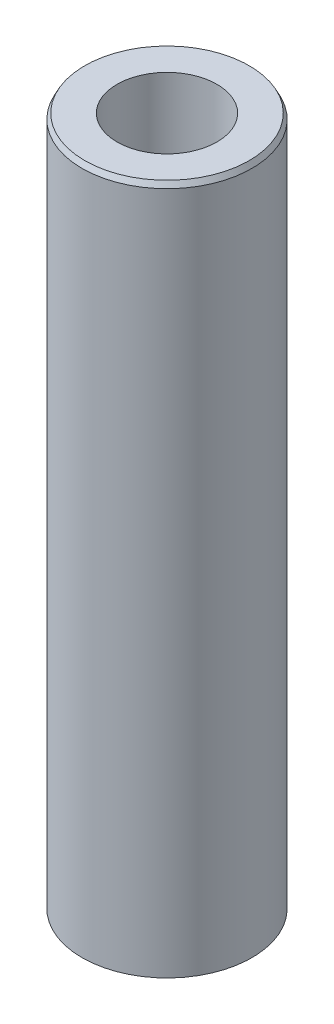
from build123d import *
from OCP.BRepFilletAPI import BRepFilletAPI_MakeChamfer

# Parameters (mm, degrees)
SKETCH1_R           = 47.5
BOSS_EXTRUDE1_DEPTH = 386.580082603
SKETCH2_R           = 27.935158564
CUT_EXTRUDE1_DEPTH  = 393.373113587
CHAMFER1_SIZE       = 3.001552716
CHAMFER1_SIZE2      = 1.53381581


with BuildPart() as part:
    # Sketch1 → Boss-Extrude1 (new body)
    with BuildSketch(Plane(origin=(0, 0, 0), x_dir=(1, 0, 0), z_dir=(0, 1, 0))):
        Circle(SKETCH1_R)
    extrude(amount=BOSS_EXTRUDE1_DEPTH)

    # Sketch2 → Cut-Extrude1 (cut, through all)
    with BuildSketch(Plane(origin=(0, 0, 0), x_dir=(1, 0, 0), z_dir=(0, 1, 0))):
        Circle(SKETCH2_R)
    extrude(amount=CUT_EXTRUDE1_DEPTH, mode=Mode.SUBTRACT)

    # Chamfer1: one chamfer whose edges measure the first distance from different faces: ONE call of the kernel's chamfer builder (chamfer() names one face for all edges)
    chamfer1_edges_1 = [part.edges().sort_by_distance(p)[0] for p in [
        (-47.5, 386.580082603, 0),
    ]]
    chamfer1_side_1 = [part.faces().sort_by_distance(p)[0] for p in [
        (-47.5, 193.290041302, 0),
    ]]
    chamfer1_edges_2 = [part.edges().sort_by_distance(p)[0] for p in [
        (-47.5, 0, 0),
    ]]
    chamfer1_side_2 = [part.faces().sort_by_distance(p)[0] for p in [
        (-46.156497116, 0, 0),
    ]]
    chamfer1 = BRepFilletAPI_MakeChamfer(part.part.solid().wrapped)
    for e in chamfer1_edges_1:
        chamfer1.Add(CHAMFER1_SIZE, CHAMFER1_SIZE2, e.wrapped, chamfer1_side_1[0].wrapped)  # the first distance lies on this face
    for e in chamfer1_edges_2:
        chamfer1.Add(CHAMFER1_SIZE, CHAMFER1_SIZE2, e.wrapped, chamfer1_side_2[0].wrapped)  # the first distance lies on this face
    add(Compound.cast(chamfer1.Shape()), mode=Mode.REPLACE)


solid = part.part
